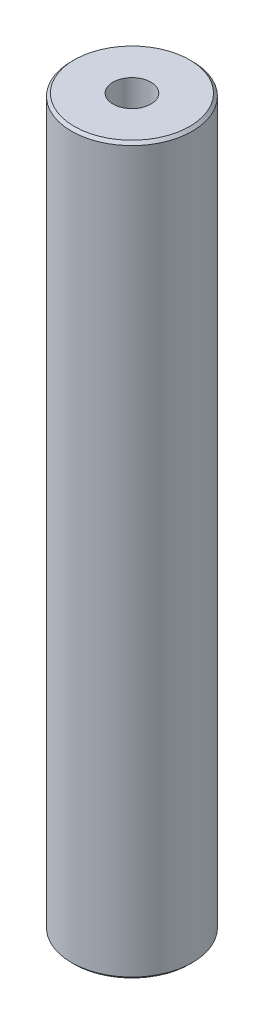
from build123d import *

# Parameters (mm, degrees)
SKETCH1_R           = 50
BOSS_EXTRUDE1_DEPTH = 600
SKETCH2_R           = 15.710885389
CUT_EXTRUDE1_DEPTH  = 605.15229868
CHAMFER1_SIZE       = 2.274660805


with BuildPart() as part:
    # Sketch1 → Boss-Extrude1 (new body)
    with BuildSketch(Plane(origin=(0, 0, 0), x_dir=(1, 0, 0), z_dir=(0, 1, 0))):
        Circle(SKETCH1_R)
    extrude(amount=BOSS_EXTRUDE1_DEPTH)

    # Sketch2 → Cut-Extrude1 (cut, through all)
    with BuildSketch(Plane(origin=(0, 0, 0), x_dir=(1, 0, 0), z_dir=(0, 1, 0))):
        Circle(SKETCH2_R)
    extrude(amount=CUT_EXTRUDE1_DEPTH, mode=Mode.SUBTRACT)

    # Chamfer1
    chamfer1_edges = [part.edges().sort_by_distance(p)[0] for p in [
        (-50, 600, 0),
        (-50, 0, 0),
    ]]
    chamfer(chamfer1_edges, length=CHAMFER1_SIZE)


solid = part.part
